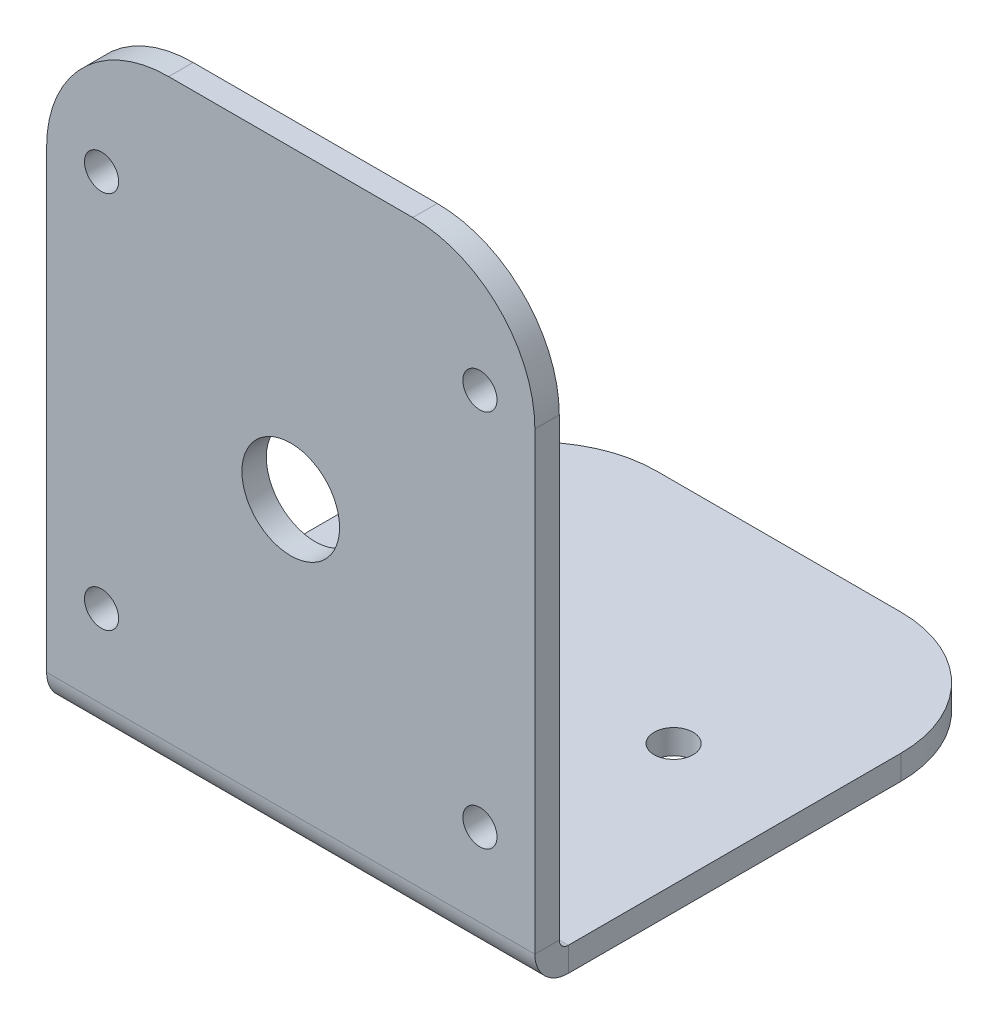
from build123d import *

# Parameters (mm, degrees)
SKETCH1_W                    = 40
SKETCH1_H                    = 50
BASE_FLANGE1_DEPTH           = 2
EDGE_FLANGE1_STRIP_W         = 9.4732
EDGE_FLANGE1_STRIP_H         = 2
EDGE_FLANGE1_STRIP_CUT_DEPTH = 40
EDGE_FLANGE1_DEPTH           = 40
CUT_EXTRUDE1_REACH           = 51.689
SKETCH9_R                    = 1.4
SKETCH9_R_2                  = 4
CUT_EXTRUDE2_REACH           = 69.082
SKETCH11_R                   = 1.6
FILLET1_R                    = 10


# Sheet-metal steps are written as plain solids
with BuildPart() as part:
    # Sketch1 → Base-Flange1 (new body)
    with BuildSketch(Plane.XY):
        Rectangle(SKETCH1_W, SKETCH1_H)
    extrude(amount=-BASE_FLANGE1_DEPTH)

    # Edge-Flange1 strip (across the edge) → Edge-Flange1 strip cut (cut)
    with BuildSketch(Plane(origin=(20, -25, -2), x_dir=(0, 1, 0), z_dir=(-1, 0, 0))):
        with Locations((-2, -1)):
            Rectangle(EDGE_FLANGE1_STRIP_W, EDGE_FLANGE1_STRIP_H)
    extrude(amount=EDGE_FLANGE1_STRIP_CUT_DEPTH, mode=Mode.SUBTRACT)

    # Edge-Flange1 section (across the edge) → Edge-Flange1 (add)
    with BuildSketch(Plane(origin=(20, -25, -2), x_dir=(0, 1, 0), z_dir=(-1, 0, 0))):
        with BuildLine():
            Line((0, 0.7366), (0, 38))
            Line((0, 38), (2, 38))
            Line((2, 38), (2, 0.7366))
            ThreePointArc((2, 0.7366), (2.215745145, 0.215745145), (2.7366, 0))
            Line((2.7366, 0), (2.7366, -2))
            ThreePointArc((2.7366, -2), (0.801531583, -1.198468417), (0, 0.7366))
        make_face()
    extrude(amount=EDGE_FLANGE1_DEPTH)

    # Sketch9 → Cut-Extrude1 (cut, up to next)
    with BuildSketch(Plane(origin=(0, 0, -2), x_dir=(-1, 0, 0), z_dir=(0, 0, -1)), mode=Mode.PRIVATE) as cut_extrude1_sk1:
        with Locations((-15.5, 15.5)):
            Circle(SKETCH9_R)
    cut_extrude1_tool1 = extrude(cut_extrude1_sk1.sketch, amount=-CUT_EXTRUDE1_REACH, mode=Mode.PRIVATE) & part.part
    # Sketch9 → Cut-Extrude1 (cut, up to next)
    with BuildSketch(Plane(origin=(0, 0, -2), x_dir=(-1, 0, 0), z_dir=(0, 0, -1)), mode=Mode.PRIVATE) as cut_extrude1_sk2:
        with Locations((15.5, 15.5)):
            Circle(SKETCH9_R)
    cut_extrude1_tool2 = extrude(cut_extrude1_sk2.sketch, amount=-CUT_EXTRUDE1_REACH, mode=Mode.PRIVATE) & part.part
    # Sketch9 → Cut-Extrude1 (cut, up to next)
    with BuildSketch(Plane(origin=(0, 0, -2), x_dir=(-1, 0, 0), z_dir=(0, 0, -1)), mode=Mode.PRIVATE) as cut_extrude1_sk3:
        with Locations((15.5, -15.5)):
            Circle(SKETCH9_R)
    cut_extrude1_tool3 = extrude(cut_extrude1_sk3.sketch, amount=-CUT_EXTRUDE1_REACH, mode=Mode.PRIVATE) & part.part
    # Sketch9 → Cut-Extrude1 (cut, up to next)
    with BuildSketch(Plane(origin=(0, 0, -2), x_dir=(-1, 0, 0), z_dir=(0, 0, -1)), mode=Mode.PRIVATE) as cut_extrude1_sk4:
        with Locations((-15.5, -15.5)):
            Circle(SKETCH9_R)
    cut_extrude1_tool4 = extrude(cut_extrude1_sk4.sketch, amount=-CUT_EXTRUDE1_REACH, mode=Mode.PRIVATE) & part.part
    # Sketch9 → Cut-Extrude1 (cut, up to next)
    with BuildSketch(Plane(origin=(0, 0, -2), x_dir=(-1, 0, 0), z_dir=(0, 0, -1)), mode=Mode.PRIVATE) as cut_extrude1_sk5:
        Circle(SKETCH9_R_2)
    cut_extrude1_tool5 = extrude(cut_extrude1_sk5.sketch, amount=-CUT_EXTRUDE1_REACH, mode=Mode.PRIVATE) & part.part
    add(cut_extrude1_tool1.solids().sort_by_distance((15.5, 15.5, -2))[0], mode=Mode.SUBTRACT)
    add(cut_extrude1_tool2.solids().sort_by_distance((-15.5, 15.5, -2))[0], mode=Mode.SUBTRACT)
    add(cut_extrude1_tool3.solids().sort_by_distance((-15.5, -15.5, -2))[0], mode=Mode.SUBTRACT)
    add(cut_extrude1_tool4.solids().sort_by_distance((15.5, -15.5, -2))[0], mode=Mode.SUBTRACT)
    add(cut_extrude1_tool5.solids().sort_by_distance((0, 0, -2))[0], mode=Mode.SUBTRACT)

    # Sketch11 → Cut-Extrude2 (cut, up to next)
    with BuildSketch(Plane.XZ.offset(25), mode=Mode.PRIVATE) as cut_extrude2_sk1:
        with Locations(Location((-10, -21.3683, 0), (0, 0, 270))):
            Circle(SKETCH11_R)
    cut_extrude2_tool1 = extrude(cut_extrude2_sk1.sketch, amount=-CUT_EXTRUDE2_REACH, mode=Mode.PRIVATE) & part.part
    # Sketch11 → Cut-Extrude2 (cut, up to next)
    with BuildSketch(Plane.XZ.offset(25), mode=Mode.PRIVATE) as cut_extrude2_sk2:
        with Locations(Location((10, -21.3683, 0), (0, 0, 270))):
            Circle(SKETCH11_R)
    cut_extrude2_tool2 = extrude(cut_extrude2_sk2.sketch, amount=-CUT_EXTRUDE2_REACH, mode=Mode.PRIVATE) & part.part
    add(cut_extrude2_tool1.solids().sort_by_distance((-10, -25, -21.3683))[0], mode=Mode.SUBTRACT)
    add(cut_extrude2_tool2.solids().sort_by_distance((10, -25, -21.3683))[0], mode=Mode.SUBTRACT)

    # Fillet1
    fillet1_edges = [part.edges().sort_by_distance(p)[0] for p in [
        (20, -24, -40),
        (-20, -24, -40),
        (-20, 25, -1),
        (20, 25, -1),
    ]]
    fillet(fillet1_edges, radius=FILLET1_R)


solid = part.part
